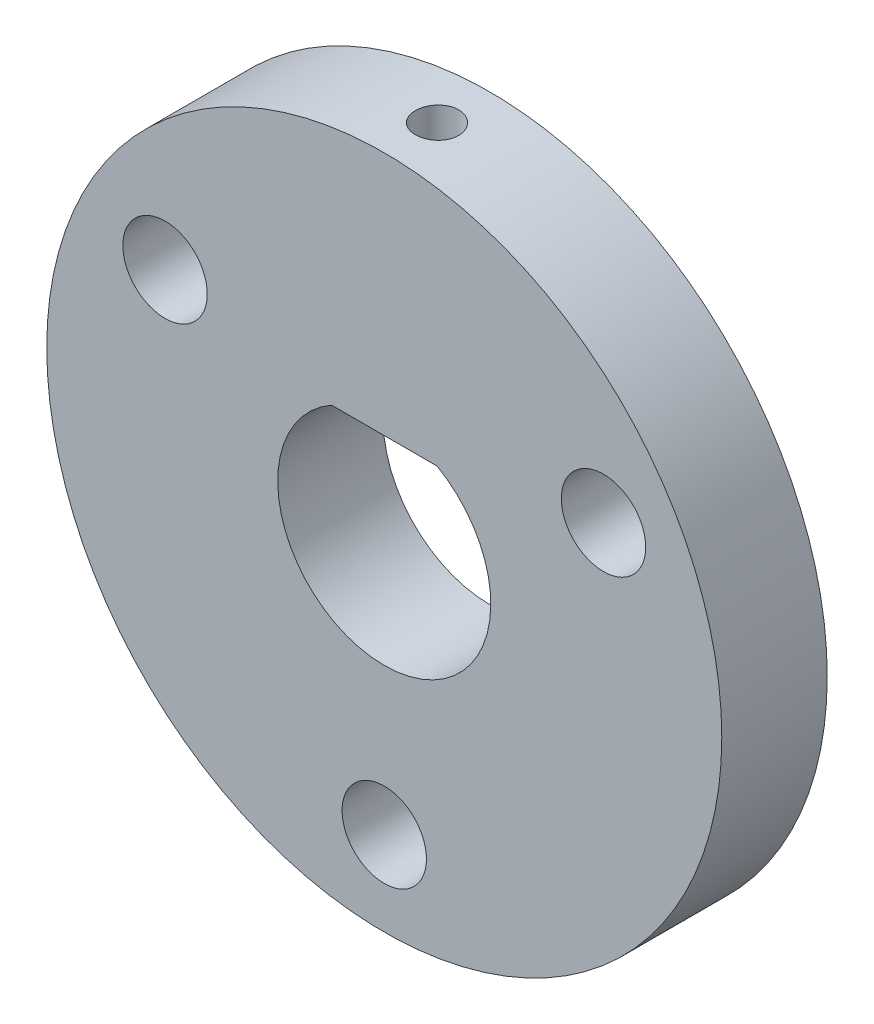
from build123d import *

# Parameters (mm, degrees)
SKETCH1_R            = 16
BOSS_EXTRUDE1_DEPTH  = 2.5
M4_CLEARANCE_HOLE2_D = 4
CIRPATTERN1_COUNT    = 3
SKETCH7_W            = 1.025
SKETCH7_H            = 11.612232914


with BuildPart() as part:
    # Sketch1 → Boss-Extrude1 (new, symmetric)
    with BuildSketch(Plane.XY):
        Circle(SKETCH1_R)
        with BuildLine():
            Line((-2.5, 4.387767086), (2.5, 4.387767086))
            ThreePointArc((2.5, 4.387767086), (0, -5.05), (-2.5, 4.387767086))
        make_face(mode=Mode.SUBTRACT)
    extrude(amount=BOSS_EXTRUDE1_DEPTH, both=True)

    # M4 Clearance Hole2 (through all)
    with Locations(Plane.XY.offset(2.5)):
        with Locations((0, -12)):
            m4_clearance_hole2 = Hole(M4_CLEARANCE_HOLE2_D / 2)

    # CirPattern1: M4 Clearance Hole2 ×3 about axis
    cirpattern1_axis = Axis((0, 0, 2.5), (0, 0, -1))
    for i in range(1, CIRPATTERN1_COUNT):
        add(m4_clearance_hole2.rotate(cirpattern1_axis, i * 360 / CIRPATTERN1_COUNT), mode=Mode.SUBTRACT)

    # Sketch7 → M2.5x0.45 Tapped Hole1 (revolve, cut)
    with BuildSketch(Plane(origin=(0, 4.387767086, 0), x_dir=(0, 0, -1), z_dir=(1, 0, 0))):
        with Locations((0.5125, 5.806116457)):
            Rectangle(SKETCH7_W, SKETCH7_H)
    revolve(axis=Axis((0, -1.962232914, 0), (0, 1, 0)), mode=Mode.SUBTRACT)


solid = part.part
